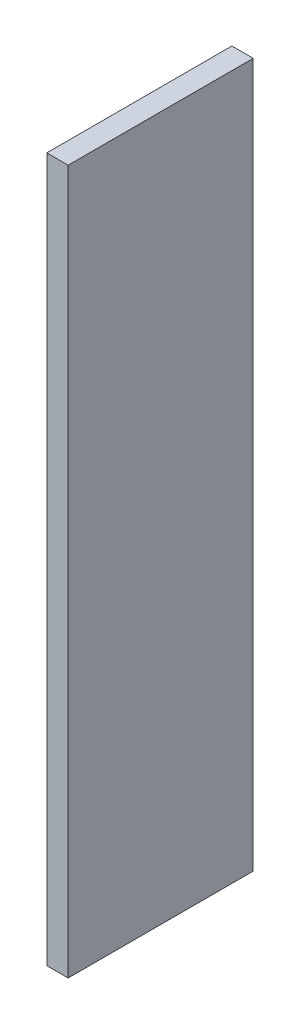
from build123d import *

# Parameters (mm, degrees)
SKETCH1_W           = 165.1
SKETCH1_H           = 627.888
BOSS_EXTRUDE1_DEPTH = 19.05


with BuildPart() as part:
    # Sketch1 → Boss-Extrude1 (new body)
    with BuildSketch(Plane(origin=(0, 0, 0), x_dir=(0, 0, -1), z_dir=(1, 0, 0))):
        with Locations((17.388307312, -231.966386618)):
            Rectangle(SKETCH1_W, SKETCH1_H)
    extrude(amount=BOSS_EXTRUDE1_DEPTH)


solid = part.part
